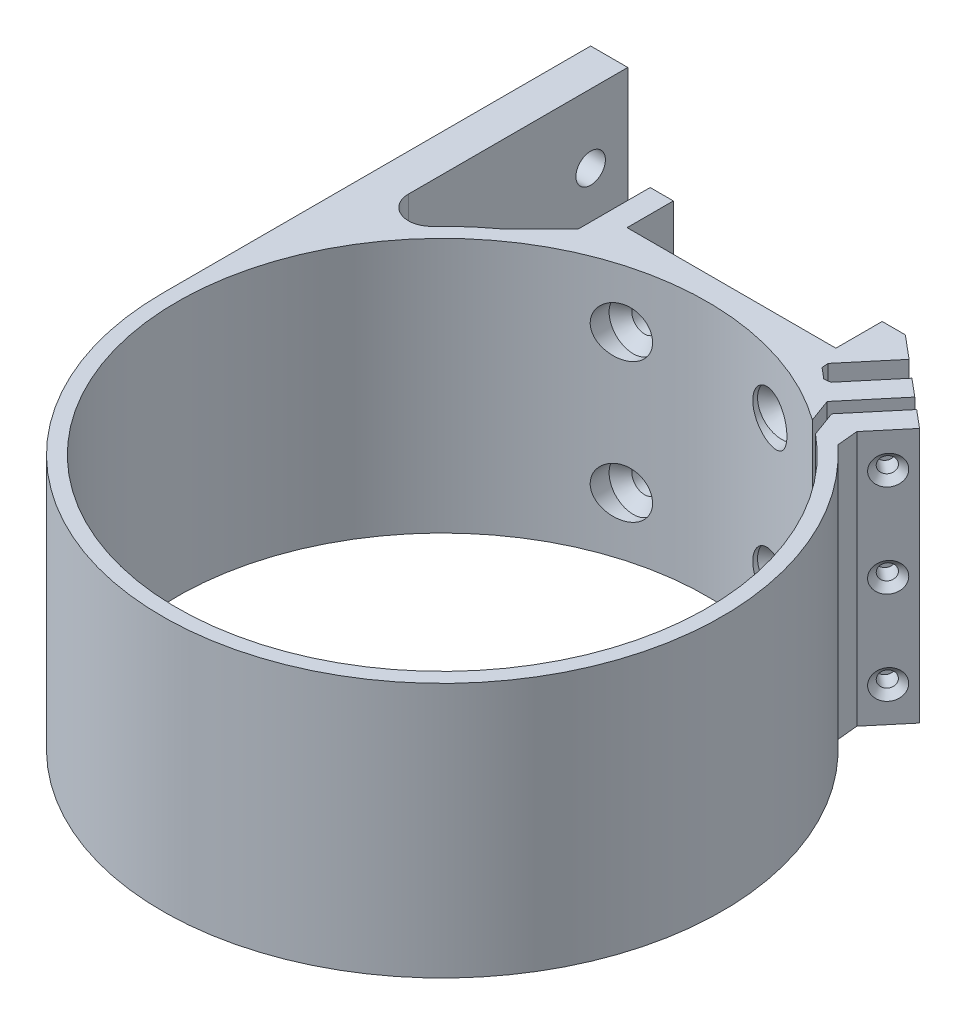
from build123d import *

# Parameters (mm, degrees)
BOSS_EXTRUDE1_DEPTH                             = 27.5
SKETCH4_W                                       = 45
SKETCH4_H                                       = 9.976183447
BOSS_EXTRUDE2_DEPTH                             = 4.5
CSK_FOR_M5_FLAT_HEAD_MACHINE_SCREW1_AT_2_COUNT  = 2
CSK_FOR_M5_FLAT_HEAD_MACHINE_SCREW1_AT_2_PITCH  = 32
CSK_FOR_M5_FLAT_HEAD_MACHINE_SCREW1_AT_3_COUNT  = 2
CSK_FOR_M5_FLAT_HEAD_MACHINE_SCREW1_AT_3_PITCH  = 43.863424399
CSK_FOR_M5_FLAT_HEAD_MACHINE_SCREW1_AT_4_COUNT  = 2
CSK_FOR_M5_FLAT_HEAD_MACHINE_SCREW1_AT_4_PITCH  = 30
CUT_EXTRUDE1_REACH                              = 136.892
CUT_EXTRUDE1_END_RADIUS                         = 57.15
SKETCH13_R                                      = 5.2
CHAMFER1_SIZE                                   = 3.142829186
CHAMFER1_SIZE_2                                 = 3.175
CHAMFER2_SIZE                                   = 1
CSK_FOR_M3_FLAT_HEAD_MACHINE_SCREW1_D           = 3.4
CSK_FOR_M3_FLAT_HEAD_MACHINE_SCREW1_DEPTH       = 15
CSK_FOR_M3_FLAT_HEAD_MACHINE_SCREW1_CSINK_D     = 6.3
CSK_FOR_M3_FLAT_HEAD_MACHINE_SCREW1_CSINK_ANGLE = 90
CSK_FOR_M3_FLAT_HEAD_MACHINE_SCREW1_TIP         = 1.021463052
FILLET2_R                                       = 5
SKETCH14_R                                      = 3.175
CUT_EXTRUDE2_DEPTH                              = 10


with BuildPart() as part:
    # Sketch1 → Boss-Extrude1 (new, symmetric)
    with BuildSketch(Plane(origin=(0, 0, 0), x_dir=(1, 0, 0), z_dir=(0, 1, 0))):
        with BuildLine():
            Line((-27.5, 53.692230583), (-27.5, 72.301183447))
            Line((-27.5, 72.301183447), (-22.5, 72.301183447))
            Line((-22.5, 72.301183447), (-22.5, 62.325))
            Line((-22.5, 62.325), (22.5, 62.325))
            Line((22.5, 62.325), (22.5, 72.301183447))
            Line((22.5, 72.301183447), (27.5, 72.301183447))
            Line((27.5, 72.301183447), (32.466110956, 68.134121575))
            Line((32.466110956, 68.134121575), (23.851795776, 57.867980511))
            Line((23.851795776, 57.867980511), (27.682017991, 54.654042463))
            Line((27.682017991, 54.654042463), (36.296333172, 64.920183527))
            Line((36.296333172, 64.920183527), (40.126555387, 61.706245479))
            Line((40.126555387, 61.706245479), (31.512240207, 51.440104414))
            Line((31.512240207, 51.440104414), (33.340523926, 46.41693618))
            ThreePointArc((33.340523926, 46.41693618), (-34.836825197, -45.304725032), (36.296051801, 44.144298881))
            Line((36.296051801, 44.144298881), (34.301778965, 49.623518465))
            Line((34.301778965, 49.623518465), (42.658017891, 59.582096225))
            Line((42.658017891, 59.582096225), (46.488240107, 56.368158177))
            Line((46.488240107, 56.368158177), (38.298629476, 46.608160286))
            ThreePointArc((38.298629476, 46.608160286), (25.775383623, -54.541133322), (-60.325, 0))
            Line((-60.325, 0), (-60.325, 92.301183447))
            Line((-60.325, 92.301183447), (-52.325, 92.301183447))
            Line((-52.325, 92.301183447), (-52.325, 30.019993338))
            ThreePointArc((-52.325, 30.019993338), (-41.63053399, 43.657808748), (-27.5, 53.692230583))
        make_face()
    extrude(amount=BOSS_EXTRUDE1_DEPTH, both=True)

    # Sketch4 → Boss-Extrude2 (add)
    with BuildSketch(Plane.XZ.offset(27.5)):
        with Locations((0, -67.313091724)):
            Rectangle(SKETCH4_W, SKETCH4_H)
    extrude(amount=-BOSS_EXTRUDE2_DEPTH)

    # Sketch12 → CSK for M5 Flat Head Machine Screw1 (revolve, cut)
    with BuildSketch(Plane(origin=(-16, 15, -57.15), x_dir=(0, -1, 0), z_dir=(1, 0, 0))):
        Polygon((0, 0), (0, 35.151183447), (2.75, 35.151183447), (2.75, 2.45), (5.2, 0), align=None)
    csk_for_m5_flat_head_machine_screw1 = revolve(axis=Axis((-16, 15, -50.8), (0, 0, -1)), mode=Mode.SUBTRACT)

    # CSK for M5 Flat Head Machine Screw1 at 2: CSK for M5 Flat Head Machine Screw1 ×2
    with Locations(*[(i * CSK_FOR_M5_FLAT_HEAD_MACHINE_SCREW1_AT_2_PITCH, 0, 0) for i in range(1, CSK_FOR_M5_FLAT_HEAD_MACHINE_SCREW1_AT_2_COUNT)]):
        add(csk_for_m5_flat_head_machine_screw1, mode=Mode.SUBTRACT)

    # CSK for M5 Flat Head Machine Screw1 at 3: CSK for M5 Flat Head Machine Screw1 ×2
    with Locations(*[Vector(0.7295372041400852, -0.6839411288813297, 0) * (i * CSK_FOR_M5_FLAT_HEAD_MACHINE_SCREW1_AT_3_PITCH) for i in range(1, CSK_FOR_M5_FLAT_HEAD_MACHINE_SCREW1_AT_3_COUNT)]):
        add(csk_for_m5_flat_head_machine_screw1, mode=Mode.SUBTRACT)

    # CSK for M5 Flat Head Machine Screw1 at 4: CSK for M5 Flat Head Machine Screw1 ×2
    with Locations(*[(0, -i * CSK_FOR_M5_FLAT_HEAD_MACHINE_SCREW1_AT_4_PITCH, 0) for i in range(1, CSK_FOR_M5_FLAT_HEAD_MACHINE_SCREW1_AT_4_COUNT)]):
        add(csk_for_m5_flat_head_machine_screw1, mode=Mode.SUBTRACT)

    # Cut-Extrude1: up to this cylinder (the profile starts outside it)
    cut_extrude1_end = Plane(origin=(0, 0, 0), z_dir=(0, -1, 0)) * Cylinder(CUT_EXTRUDE1_END_RADIUS, 419.084, mode=Mode.PRIVATE)
    # Sketch13 → Cut-Extrude1 (cut, up to the surface)
    with BuildSketch(Plane.XY.offset(-57.15), mode=Mode.PRIVATE) as cut_extrude1_sk1:
        with Locations(Location((-16, -15, 0), (0, 0, 180))):
            Circle(SKETCH13_R)
    cut_extrude1_tool1 = extrude(cut_extrude1_sk1.sketch, amount=CUT_EXTRUDE1_REACH, mode=Mode.PRIVATE) - cut_extrude1_end
    add(cut_extrude1_tool1.solids().sort_by_distance((-16, -15, -57.15))[0], mode=Mode.SUBTRACT)
    # Sketch13 → Cut-Extrude1 (cut, up to the surface)
    with BuildSketch(Plane.XY.offset(-57.15), mode=Mode.PRIVATE) as cut_extrude1_sk2:
        with Locations(Location((16, -15, 0), (0, 0, 180))):
            Circle(SKETCH13_R)
    cut_extrude1_tool2 = extrude(cut_extrude1_sk2.sketch, amount=CUT_EXTRUDE1_REACH, mode=Mode.PRIVATE) - cut_extrude1_end
    add(cut_extrude1_tool2.solids().sort_by_distance((16, -15, -57.15))[0], mode=Mode.SUBTRACT)
    # Sketch13 → Cut-Extrude1 (cut, up to the surface)
    with BuildSketch(Plane.XY.offset(-57.15), mode=Mode.PRIVATE) as cut_extrude1_sk3:
        with Locations(Location((16, 15, 0), (0, 0, 180))):
            Circle(SKETCH13_R)
    cut_extrude1_tool3 = extrude(cut_extrude1_sk3.sketch, amount=CUT_EXTRUDE1_REACH, mode=Mode.PRIVATE) - cut_extrude1_end
    add(cut_extrude1_tool3.solids().sort_by_distance((16, 15, -57.15))[0], mode=Mode.SUBTRACT)
    # Sketch13 → Cut-Extrude1 (cut, up to the surface)
    with BuildSketch(Plane.XY.offset(-57.15), mode=Mode.PRIVATE) as cut_extrude1_sk4:
        with Locations(Location((-16, 15, 0), (0, 0, 180))):
            Circle(SKETCH13_R)
    cut_extrude1_tool4 = extrude(cut_extrude1_sk4.sketch, amount=CUT_EXTRUDE1_REACH, mode=Mode.PRIVATE) - cut_extrude1_end
    add(cut_extrude1_tool4.solids().sort_by_distance((-16, 15, -57.15))[0], mode=Mode.SUBTRACT)

    # Chamfer1
    # the kernel refuses this chamfer: 7.31254539, 3.175, 3.142829186 mm, written as the material it adds along each edge
    with BuildSketch(Plane(origin=(38.298629476, 27.5, -46.608160286), x_dir=(0.6427876096865355, 0, -0.7660444431189813), z_dir=(0, -1, 0))) as chamfer1_piece_1:
        with BuildLine():
            Line((CHAMFER1_SIZE, 0), (-0.054749246, 3.264067078))
            ThreePointArc((-0.054749246, 3.264067078), (-0.006082575, 1.678547233), (0, 0))
            Line((0, 0), (CHAMFER1_SIZE, 0))
        make_face()
    extrude(amount=55)
    with BuildSketch(Plane(origin=(-27.5, -27.5, -53.692230583), x_dir=(0, 0, -1), z_dir=(0, 1, 0))) as chamfer1_piece_2:
        with BuildLine():
            Line((CHAMFER1_SIZE_2, 0), (-5.17652137, 8.35152137))
            ThreePointArc((-5.17652137, 8.35152137), (-2.493388985, 4.40273098), (0, 0))
            Line((0, 0), (CHAMFER1_SIZE_2, 0))
        make_face()
    extrude(amount=55)

    # Chamfer2
    chamfer2_edges = [part.edges().sort_by_distance(p)[0] for p in [
        (23.851795776, 0, -57.867980511),
        (27.682017991, 0, -54.654042463),
    ]]
    chamfer(chamfer2_edges, length=CHAMFER2_SIZE)

    # CSK for M3 Flat Head Machine Screw1
    with Locations(Plane(origin=(-0.475480456, 0, -0.398975475), x_dir=(0.6427876096865344, 0, -0.7660444431189822), z_dir=(0.7660444431189822, 0, 0.6427876096865344))):
        with Locations((68.263607475, 20), (68.263607475, 0), (68.263607475, -20)):
            CounterSinkHole(CSK_FOR_M3_FLAT_HEAD_MACHINE_SCREW1_D / 2, CSK_FOR_M3_FLAT_HEAD_MACHINE_SCREW1_CSINK_D / 2, depth=CSK_FOR_M3_FLAT_HEAD_MACHINE_SCREW1_DEPTH, counter_sink_angle=CSK_FOR_M3_FLAT_HEAD_MACHINE_SCREW1_CSINK_ANGLE)
            with Locations((0, 0, -(CSK_FOR_M3_FLAT_HEAD_MACHINE_SCREW1_DEPTH + CSK_FOR_M3_FLAT_HEAD_MACHINE_SCREW1_TIP / 2))):  # 118° drill point
                Cone(0, CSK_FOR_M3_FLAT_HEAD_MACHINE_SCREW1_D / 2, CSK_FOR_M3_FLAT_HEAD_MACHINE_SCREW1_TIP, mode=Mode.SUBTRACT)

    # Fillet2
    fillet2_edges = [part.edges().sort_by_distance(p)[0] for p in [
        (-52.325, 0, -30.019993338),
    ]]
    fillet(fillet2_edges, radius=FILLET2_R)

    # Sketch14 → Cut-Extrude2 (cut)
    with BuildSketch(Plane(origin=(-52.325, 0, 0), x_dir=(0, 0, -1), z_dir=(1, 0, 0))):
        with Locations((84.301183447, 12.7)):
            Circle(SKETCH14_R)
        with Locations((84.301183447, -12.7)):
            Circle(SKETCH14_R)
    extrude(amount=-CUT_EXTRUDE2_DEPTH, mode=Mode.SUBTRACT)


solid = part.part
